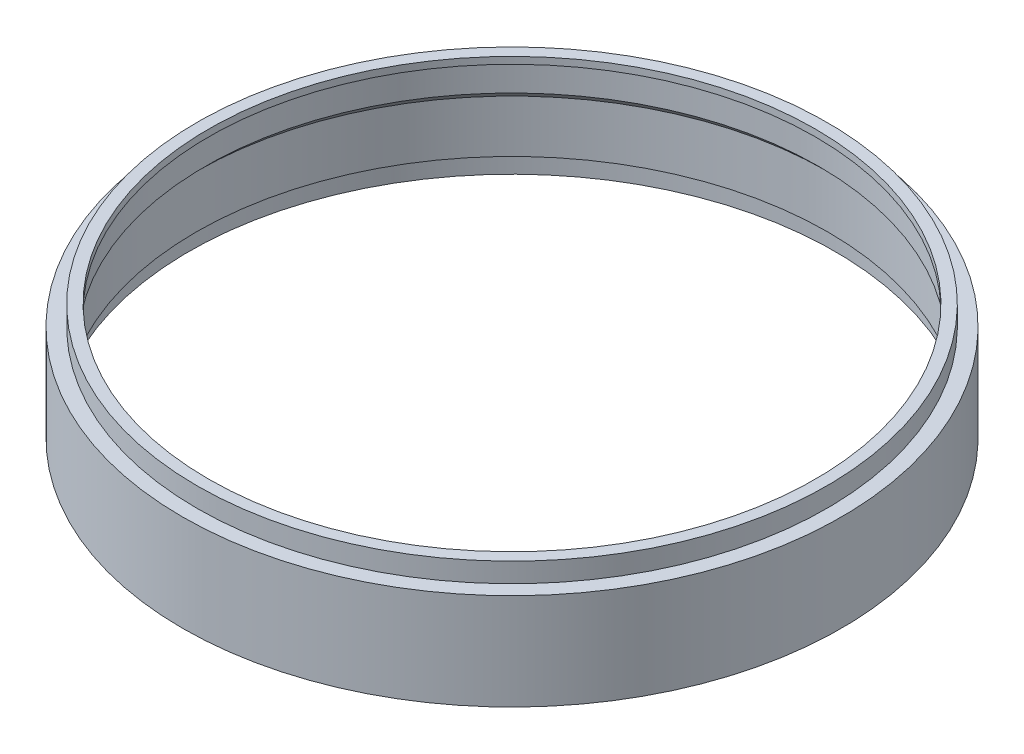
from build123d import *


with BuildPart() as part:
    # Sketch1 → Revolve1 (revolve)
    with BuildSketch(Plane.XY):
        Polygon((-48.35, 0), (-48.35, 14.15), (-46.2, 14.15), (-46.2, 17.019999369), (-44.5, 17.019999369), (-44.5, 16.019999369), (-45, 16.019999369), (-45, 12.019999369), (-46.35, 10.669999369), (-46.35, 3), (-47.4, 3), (-47.4, 0), align=None)
    revolve(axis=Axis((0, 0, 0), (0, -1, 0)))


solid = part.part
